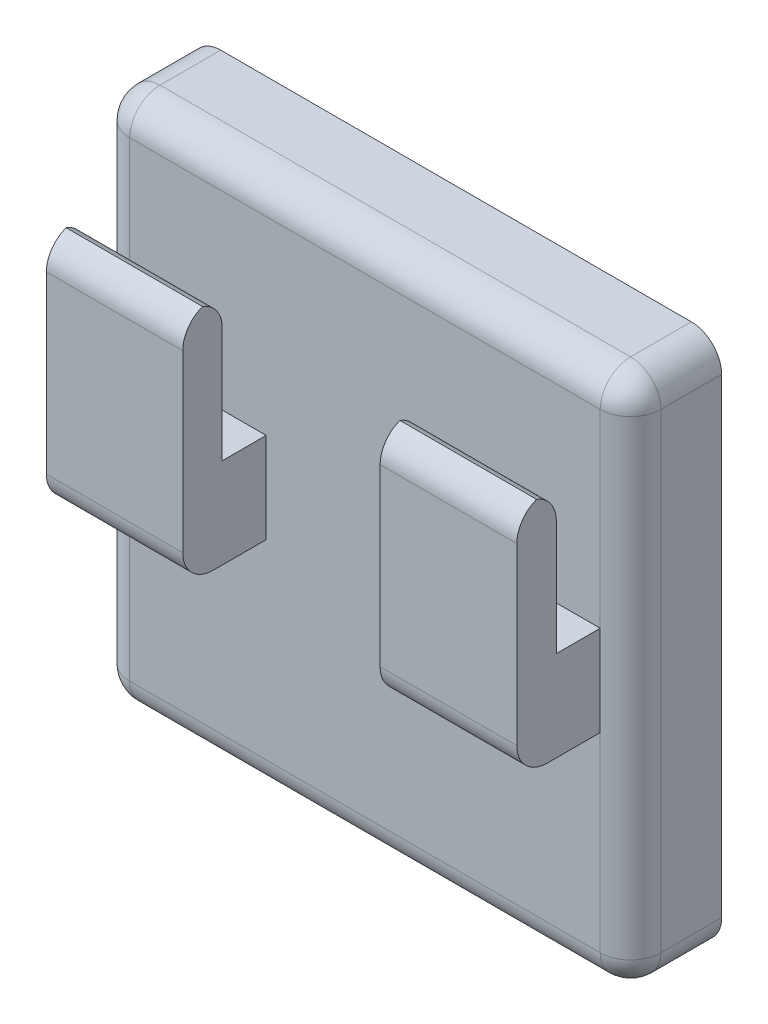
from build123d import *

# Parameters (mm, degrees)
BOSS_EXTRUDE1_DEPTH     = 44.45
CUT_EXTRUDE1_DEPTH      = 6.35
CUT_EXTRUDE1_DEPTH_BACK = 3.81
SKETCH2_W               = 2.54
SKETCH2_H               = 19.817543538
CUT_EXTRUDE2_DEPTH      = 5.08
CUT_EXTRUDE2_DEPTH_BACK = 3.81
SKETCH4_W               = 2.544966755
SKETCH4_H               = 19.817543538
CUT_EXTRUDE3_DEPTH      = 5.08
CUT_EXTRUDE3_DEPTH_BACK = 3.81
SKETCH8_W               = 16.513276495
SKETCH8_H               = 19.817543538
FILLET3_DEPTH           = 44.45
FILLET3_START           = 7
FILLET3_2_DEPTH         = 47
FILLET4_R               = 2.54
FILLET5_R               = 2.54
FILLET6_R               = 2.54


with BuildPart() as part:
    # Sketch1 → Boss-Extrude1 (new body)
    with BuildSketch(Plane(origin=(0, 0, 0), x_dir=(0, 0, -1), z_dir=(1, 0, 0))):
        Polygon((-4.141724441, 52.87490044), (-11.761724441, 52.87490044), (-11.761724441, 34.478280211), (-15.434687804, 34.478280211), (-15.434687804, 46.643996602), (-18.737279906, 46.643996602), (-18.737279906, 26.921380181), (-11.761724441, 26.921380181), (-11.761724441, 8.42490044), (-4.141724441, 8.42490044), align=None)
    extrude(amount=BOSS_EXTRUDE1_DEPTH)

    # Sketch2 → Cut-Extrude1 (cut, two sides: drawn at the far end of the back side and taken through both)
    with BuildSketch(Plane.XY.offset(15.571724441).offset(-CUT_EXTRUDE1_DEPTH_BACK)):
        with Locations((43.18, 36.735224833)):
            Rectangle(SKETCH2_W, SKETCH2_H)
    extrude(amount=CUT_EXTRUDE1_DEPTH + CUT_EXTRUDE1_DEPTH_BACK, mode=Mode.SUBTRACT)

    # Sketch4 → Cut-Extrude2 (cut, two sides: drawn at the far end of the back side and taken through both)
    with BuildSketch(Plane.XY.offset(15.571724441).offset(-CUT_EXTRUDE2_DEPTH_BACK)):
        with Locations((1.272483378, 36.735224833)):
            Rectangle(SKETCH4_W, SKETCH4_H)
    extrude(amount=CUT_EXTRUDE2_DEPTH + CUT_EXTRUDE2_DEPTH_BACK, mode=Mode.SUBTRACT)

    # Sketch8 → Cut-Extrude3 (cut, two sides: drawn at the far end of the back side and taken through both)
    with BuildSketch(Plane.XY.offset(15.571724441).offset(-CUT_EXTRUDE3_DEPTH_BACK)):
        with Locations((22.215391178, 36.735224833)):
            Rectangle(SKETCH8_W, SKETCH8_H)
    extrude(amount=CUT_EXTRUDE3_DEPTH + CUT_EXTRUDE3_DEPTH_BACK, mode=Mode.SUBTRACT)

    # Fillet3: read off the stored shape, not the designer's step
    # Fillet3 outline → Fillet3 (cut)
    with BuildSketch(Plane.YZ):
        with BuildLine():
            ThreePointArc((8.42490044, 9.221724441), (9.168849215, 11.017775666), (10.96490044, 11.761724441))
            Line((10.96490044, 11.761724441), (8.42490044, 11.761724441))
            Line((8.42490044, 11.761724441), (8.42490044, 9.221724441))
        make_face()
        with BuildLine():
            ThreePointArc((50.33490044, 11.761724441), (52.130951664, 11.017775665), (52.87490044, 9.221724441))
            Line((52.87490044, 9.221724441), (52.87490044, 11.761724441))
            Line((52.87490044, 11.761724441), (50.33490044, 11.761724441))
        make_face()
    extrude(amount=FILLET3_DEPTH, mode=Mode.SUBTRACT)

    # Fillet3 2 outline → Fillet3 2 (cut)
    with BuildSketch(Plane(origin=(0, 0, 0), x_dir=(1, 0, 0), z_dir=(0, 1, 0)).offset(FILLET3_START)):
        with BuildLine():
            Line((0, -11.761724441), (2.54, -11.761724441))
            ThreePointArc((2.54, -11.761724441), (0.743948776, -11.017775665), (0, -9.221724441))
            Line((0, -9.221724441), (0, -11.761724441))
        make_face()
        with BuildLine():
            ThreePointArc((44.45, -9.221724441), (43.706051224, -11.017775665), (41.91, -11.761724441))
            Line((41.91, -11.761724441), (44.45, -11.761724441))
            Line((44.45, -11.761724441), (44.45, -9.221724441))
        make_face()
    extrude(amount=FILLET3_2_DEPTH, mode=Mode.SUBTRACT)

    # Fillet4
    # the kernel refuses this fillet: 2.54 mm, written as the material it takes off along each edge
    with BuildSketch(Plane(origin=(41.91, 50.33490044, 9.221724441), x_dir=(1, 0, 0), z_dir=(0, 1, 0))) as fillet4_piece_1_section:
        Polygon((0, 0), (FILLET4_R, 0), (FILLET4_R, -FILLET4_R), (0, -FILLET4_R), align=None)
    fillet4_piece_1 = extrude(amount=FILLET4_R, mode=Mode.PRIVATE)
    fillet4_piece_1 = fillet4_piece_1 - Plane(origin=(41.91, 50.33490044, 9.221724441), x_dir=(-0.7071067811865475, 0, -0.7071067811865475), z_dir=(0, 1, 0)) * Sphere(FILLET4_R, mode=Mode.PRIVATE)
    add(fillet4_piece_1, mode=Mode.SUBTRACT)
    with BuildSketch(Plane(origin=(2.54, 50.33490044, 9.221724441), x_dir=(-1, 0, 0), z_dir=(0, 1, 0))) as fillet4_piece_2_section:
        Polygon((0, 0), (FILLET4_R, 0), (FILLET4_R, FILLET4_R), (0, FILLET4_R), align=None)
    fillet4_piece_2 = extrude(amount=FILLET4_R, mode=Mode.PRIVATE)
    fillet4_piece_2 = fillet4_piece_2 - Plane(origin=(2.54, 50.33490044, 9.221724441), x_dir=(0.7071067811865475, 0, -0.7071067811865475), z_dir=(0, 1, 0)) * Sphere(FILLET4_R, mode=Mode.PRIVATE)
    add(fillet4_piece_2, mode=Mode.SUBTRACT)
    with BuildSketch(Plane(origin=(41.91, 10.96490044, 9.221724441), x_dir=(0, -1, 0), z_dir=(1, 0, 0))) as fillet4_piece_3_section:
        Polygon((0, 0), (FILLET4_R, 0), (FILLET4_R, -FILLET4_R), (0, -FILLET4_R), align=None)
    fillet4_piece_3 = extrude(amount=FILLET4_R, mode=Mode.PRIVATE)
    fillet4_piece_3 = fillet4_piece_3 - Plane(origin=(41.91, 10.96490044, 9.221724441), x_dir=(0, 0.7071067811865476, -0.7071067811865475), z_dir=(1, 0, 0)) * Sphere(FILLET4_R, mode=Mode.PRIVATE)
    add(fillet4_piece_3, mode=Mode.SUBTRACT)
    with BuildSketch(Plane(origin=(2.54, 10.96490044, 9.221724441), x_dir=(0, -1, 0), z_dir=(-1, 0, 0))) as fillet4_piece_4_section:
        Polygon((0, 0), (FILLET4_R, 0), (FILLET4_R, FILLET4_R), (0, FILLET4_R), align=None)
    fillet4_piece_4 = extrude(amount=FILLET4_R, mode=Mode.PRIVATE)
    fillet4_piece_4 = fillet4_piece_4 - Plane(origin=(2.54, 10.96490044, 9.221724441), x_dir=(0, 0.7071067811865476, -0.7071067811865475), z_dir=(-1, 0, 0)) * Sphere(FILLET4_R, mode=Mode.PRIVATE)
    add(fillet4_piece_4, mode=Mode.SUBTRACT)
    with BuildSketch(Plane(origin=(0, 52.87490044, -2.208275559), x_dir=(1, 0, 0), z_dir=(0, 0, 1)), Plane(origin=(44.45, 8.42490044, 9.221724441), x_dir=(0, 1, 0), z_dir=(0, 0, -1))) as fillet4_piece_5:
        with BuildLine():
            CenterArc((FILLET4_R, -FILLET4_R), FILLET4_R, 90, 90)
            Line((0, -FILLET4_R), (0, 0))
            Line((0, 0), (FILLET4_R, 0))
        make_face()
    extrude(amount=11.43, mode=Mode.SUBTRACT)
    with BuildSketch(Plane(origin=(44.45, 52.87490044, -2.208275559), x_dir=(-1, 0, 0), z_dir=(0, 0, 1)), Plane(origin=(0, 8.42490044, 9.221724441), x_dir=(0, 1, 0), z_dir=(0, 0, -1))) as fillet4_piece_6:
        with BuildLine():
            CenterArc((FILLET4_R, FILLET4_R), FILLET4_R, 180, 90)
            Line((0, FILLET4_R), (0, 0))
            Line((0, 0), (FILLET4_R, 0))
        make_face()
    extrude(amount=11.43, mode=Mode.SUBTRACT)

    # Fillet5
    # the kernel refuses this fillet: 2.54 mm, written as the material it takes off along each edge
    with BuildSketch(Plane(origin=(24.122029425, 46.643996602, 18.737279906), x_dir=(0, -1, 0), z_dir=(1, 0, 0)), Plane(origin=(24.122029425, 46.643996602, 15.434687804), x_dir=(0, 0, 1), z_dir=(1, 0, 0))) as fillet5_piece_1:
        with BuildLine():
            CenterArc((FILLET5_R, FILLET5_R), FILLET5_R, 180, 90)
            Line((0, FILLET5_R), (0, 0))
            Line((0, 0), (FILLET5_R, 0))
        make_face()
    extrude(amount=24.137970575, mode=Mode.SUBTRACT)
    with BuildSketch(Plane(origin=(-3.805033245, 46.643996602, 18.737279906), x_dir=(0, 0, -1), z_dir=(1, 0, 0)), Plane(origin=(-3.805033245, 46.643996602, 15.434687804), x_dir=(0, -1, 0), z_dir=(1, 0, 0))) as fillet5_piece_2:
        with BuildLine():
            CenterArc((FILLET5_R, -FILLET5_R), FILLET5_R, 90, 90)
            Line((0, -FILLET5_R), (0, 0))
            Line((0, 0), (FILLET5_R, 0))
        make_face()
    extrude(amount=24.113786175, mode=Mode.SUBTRACT)

    # Fillet6
    fillet6_edges = [part.edges().sort_by_distance(p)[0] for p in [
        (36.191014713, 26.921380181, 18.737279906),
        (8.251859842, 26.921380181, 18.737279906),
    ]]
    fillet(fillet6_edges, radius=FILLET6_R)


solid = part.part
